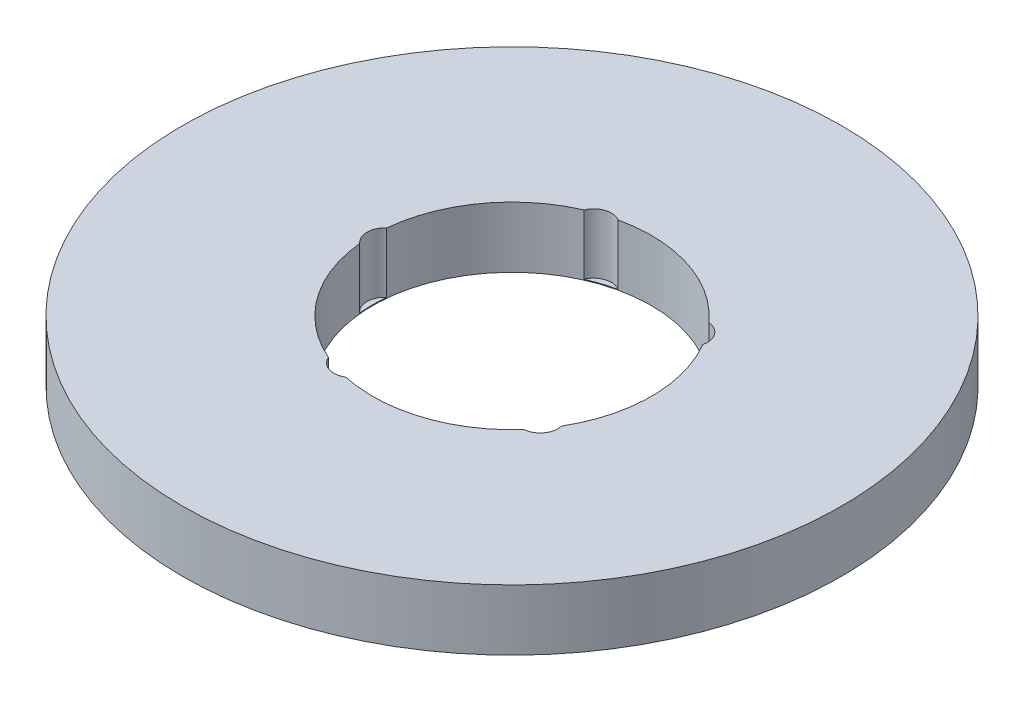
from build123d import *

# Parameters (mm, degrees)
SKETCH1_R           = 65
BOSS_EXTRUDE1_DEPTH = 12
SKETCH2_R           = 27.5
CUT_EXTRUDE1_DEPTH  = 93.703829479
SKETCH3_R           = 3.504579596
CUT_EXTRUDE2_DEPTH  = 11.84561613
CIRPATTERN1_COUNT   = 5


with BuildPart() as part:
    # Sketch1 → Boss-Extrude1 (new body)
    with BuildSketch(Plane(origin=(0, 0, 0), x_dir=(1, 0, 0), z_dir=(0, 1, 0))):
        Circle(SKETCH1_R)
    extrude(amount=BOSS_EXTRUDE1_DEPTH)

    # Sketch2 → Cut-Extrude1 (cut, through all)
    with BuildSketch(Plane(origin=(0, 0, 0), x_dir=(1, 0, 0), z_dir=(0, 1, 0))):
        Circle(SKETCH2_R)
    extrude(amount=CUT_EXTRUDE1_DEPTH, mode=Mode.SUBTRACT)

    # Sketch3 → Cut-Extrude2 (cut)
    with BuildSketch(Plane(origin=(0, 12, 0), x_dir=(1, 0, 0), z_dir=(0, 1, 0))):
        with Locations((-25.094216448, 0)):
            Circle(SKETCH3_R)
    cut_extrude2 = extrude(amount=-CUT_EXTRUDE2_DEPTH, mode=Mode.SUBTRACT)

    # CirPattern1: Cut-Extrude2 ×5 about axis
    cirpattern1_axis = Axis((0, 0, 0), (0, 1, 0))
    for i in range(1, CIRPATTERN1_COUNT):
        add(cut_extrude2.rotate(cirpattern1_axis, i * 360 / CIRPATTERN1_COUNT), mode=Mode.SUBTRACT)


solid = part.part
